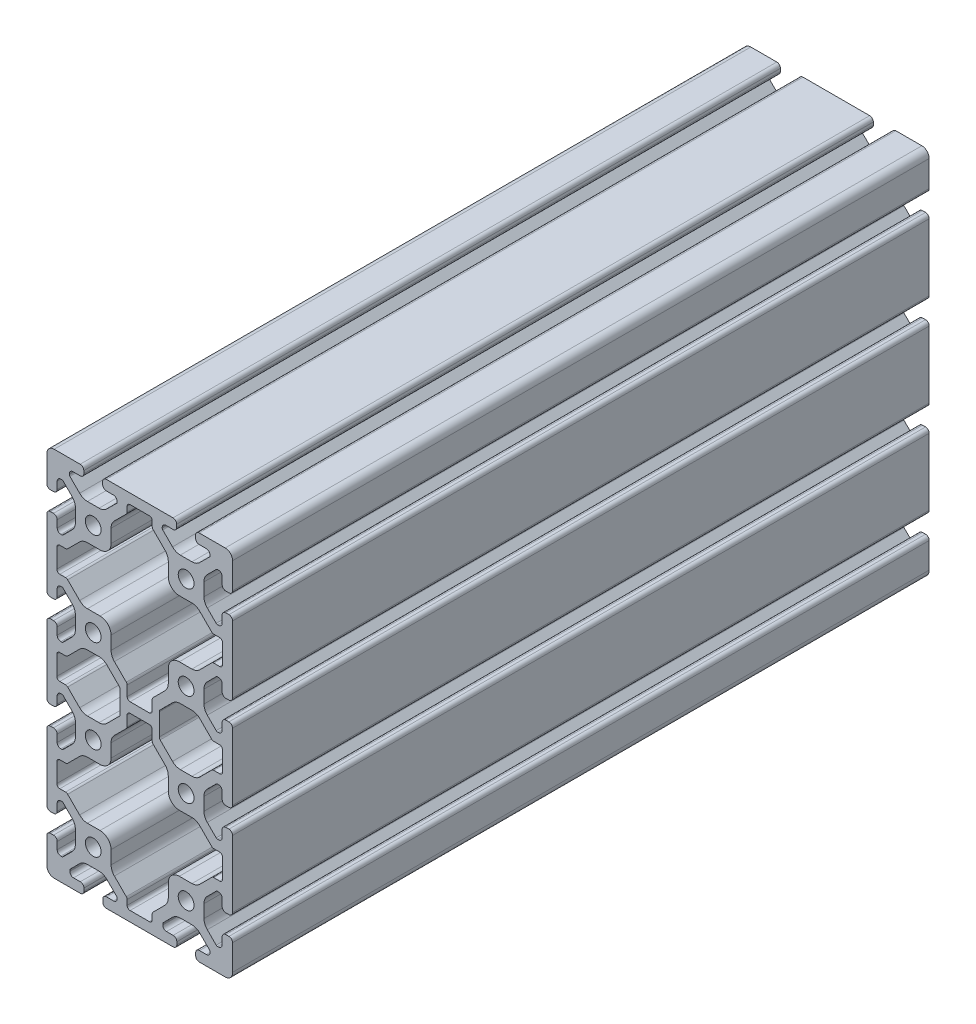
from build123d import *

# Parameters (mm, degrees)
SKETCH1_R      = 3.4
EXTRUDE1_DEPTH = 300


with BuildPart() as part:
    # Sketch1 → Extrude1 (new body)
    with BuildSketch(Plane.XY):
        with BuildLine():
            Line((18.43, 115.94), (17.094615034, 115.94))
            ThreePointArc((17.094615034, 115.94), (15.984457388, 115.480157646), (15.524615034, 114.37))
            Line((15.524615034, 114.37), (15.524615034, 111.285))
            ThreePointArc((15.524615034, 111.285), (15.064772681, 110.174842354), (13.954615034, 109.715))
            Line((13.954615034, 109.715), (13.492503602, 109.715))
            ThreePointArc((13.492503602, 109.715), (13.201664022, 109.772851626), (12.955102186, 109.937599109))
            Line((12.955102186, 109.937599109), (9.109794088, 113.782907733))
            ThreePointArc((9.109794088, 113.782907733), (8.055291919, 115.361081755), (7.685, 117.222664943))
            Line((7.685, 117.222664943), (7.685, 122.777336108))
            ThreePointArc((7.685, 122.777336108), (8.055291919, 124.638919296), (9.109794088, 126.217093319))
            Line((9.109794088, 126.217093319), (12.955102449, 130.062401679))
            ThreePointArc((12.955102449, 130.062401679), (13.201664194, 130.22714897), (13.492503602, 130.285000526))
            Line((13.492503602, 130.285000526), (13.954615034, 130.285000526))
            ThreePointArc((13.954615034, 130.285000526), (15.064772681, 129.825158172), (15.524615034, 128.715000526))
            Line((15.524615034, 128.715000526), (15.524615034, 125.630000526))
            ThreePointArc((15.524615034, 125.630000526), (15.984457388, 124.519842879), (17.094615034, 124.060000526))
            Line((17.094615034, 124.060000526), (18.43, 124.060000526))
            ThreePointArc((18.43, 124.060000526), (19.540157647, 124.519842879), (20, 125.630000526))
            Line((20, 125.630000526), (20, 136.83))
            ThreePointArc((20, 136.83), (19.071528497, 139.071528496), (16.83, 140))
            Line((16.83, 140), (5.630000526, 140))
            ThreePointArc((5.630000526, 140), (4.519842879, 139.540157646), (4.060000526, 138.43))
            Line((4.060000526, 138.43), (4.06, 137.24999625))
            ThreePointArc((4.06, 137.24999625), (4.519842354, 136.139838603), (5.63, 135.67999625))
            Line((5.63, 135.67999625), (8.715399493, 135.67999625))
            ThreePointArc((8.715399493, 135.67999625), (9.825557139, 135.220153896), (10.285399493, 134.10999625))
            Line((10.285399493, 134.10999625), (10.285399493, 133.6200547))
            ThreePointArc((10.285399493, 133.6200547), (10.160433474, 133.35903797), (9.946956001, 133.163657296))
            Line((9.946956001, 133.163657296), (5.859541494, 129.076242789))
            ThreePointArc((5.859541494, 129.076242789), (4.318530587, 128.04657222), (2.500784284, 127.685))
            Line((2.500784284, 127.685), (-2.500784284, 127.685))
            ThreePointArc((-2.500784284, 127.685), (-4.318530588, 128.04657222), (-5.859541494, 129.076242789))
            Line((-5.859541494, 129.076242789), (-10.062800646, 133.279501941))
            ThreePointArc((-10.062800646, 133.279501941), (-10.227547937, 133.526063686), (-10.285399492, 133.816903094))
            Line((-10.285399492, 133.816903094), (-10.285399492, 134.10999625))
            ThreePointArc((-10.285399492, 134.10999625), (-9.825557139, 135.220153896), (-8.715399492, 135.67999625))
            Line((-8.715399492, 135.67999625), (-5.63, 135.67999625))
            ThreePointArc((-5.63, 135.67999625), (-4.519842353, 136.139838603), (-4.06, 137.24999625))
            Line((-4.06, 137.24999625), (-4.06, 138.43))
            ThreePointArc((-4.06, 138.43), (-4.519842353, 139.540157646), (-5.63, 140))
            Line((-5.63, 140), (-34.37, 140))
            ThreePointArc((-34.37, 140), (-35.480157646, 139.540157646), (-35.94, 138.43))
            Line((-35.94, 138.43), (-35.94, 137.24999625))
            ThreePointArc((-35.94, 137.24999625), (-35.480157646, 136.139838603), (-34.37, 135.67999625))
            Line((-34.37, 135.67999625), (-31.284600508, 135.67999625))
            ThreePointArc((-31.284600508, 135.67999625), (-30.174442861, 135.220153896), (-29.714600508, 134.10999625))
            Line((-29.714600508, 134.10999625), (-29.714600508, 133.6200547))
            ThreePointArc((-29.714600508, 133.6200547), (-29.839566526, 133.35903797), (-30.053043999, 133.163657296))
            Line((-30.053043999, 133.163657296), (-34.140458506, 129.076242789))
            ThreePointArc((-34.140458506, 129.076242789), (-35.681469413, 128.04657222), (-37.499215716, 127.685))
            Line((-37.499215716, 127.685), (-42.500784284, 127.685))
            ThreePointArc((-42.500784284, 127.685), (-44.318530587, 128.04657222), (-45.859541494, 129.076242789))
            Line((-45.859541494, 129.076242789), (-50.062800646, 133.279501941))
            ThreePointArc((-50.062800646, 133.279501941), (-50.22754822, 133.526063625), (-50.285400018, 133.816903094))
            Line((-50.285400018, 133.816903094), (-50.285400018, 134.10999625))
            ThreePointArc((-50.285400018, 134.10999625), (-49.825557664, 135.220153896), (-48.715400018, 135.67999625))
            Line((-48.715400018, 135.67999625), (-45.630000525, 135.67999625))
            ThreePointArc((-45.630000525, 135.67999625), (-44.519842879, 136.139838603), (-44.060000525, 137.24999625))
            Line((-44.060000525, 137.24999625), (-44.060000525, 138.43))
            ThreePointArc((-44.060000525, 138.43), (-44.519842879, 139.540157646), (-45.630000525, 140))
            Line((-45.630000525, 140), (-56.83, 140))
            ThreePointArc((-56.83, 140), (-59.071528496, 139.071528496), (-60, 136.83))
            Line((-60, 136.83), (-60, 125.630000526))
            ThreePointArc((-60, 125.630000526), (-59.540157646, 124.519842879), (-58.43, 124.060000526))
            Line((-58.43, 124.060000526), (-57.094615034, 124.060000526))
            ThreePointArc((-57.094615034, 124.060000526), (-55.984457387, 124.519842879), (-55.524615034, 125.630000526))
            Line((-55.524615034, 125.630000526), (-55.524615034, 128.715000526))
            ThreePointArc((-55.524615034, 128.715000526), (-55.06477268, 129.825158172), (-53.954615034, 130.285000526))
            Line((-53.954615034, 130.285000526), (-53.492503602, 130.285000526))
            ThreePointArc((-53.492503602, 130.285000526), (-53.201664193, 130.22714897), (-52.955102448, 130.062401679))
            Line((-52.955102448, 130.062401679), (-49.109794088, 126.217093319))
            ThreePointArc((-49.109794088, 126.217093319), (-48.055291919, 124.638919296), (-47.685, 122.777336108))
            Line((-47.685, 122.777336108), (-47.685, 117.222664943))
            ThreePointArc((-47.685, 117.222664943), (-48.05529199, 115.361081584), (-49.109794351, 113.78290747))
            Line((-49.109794351, 113.78290747), (-52.955102448, 109.937598846))
            ThreePointArc((-52.955102448, 109.937598846), (-53.201664193, 109.772851555), (-53.492503602, 109.715))
            Line((-53.492503602, 109.715), (-53.954615034, 109.715))
            ThreePointArc((-53.954615034, 109.715), (-55.06477268, 110.174842353), (-55.524615034, 111.285))
            Line((-55.524615034, 111.285), (-55.524615034, 114.37))
            ThreePointArc((-55.524615034, 114.37), (-55.984457387, 115.480157646), (-57.094615034, 115.94))
            Line((-57.094615034, 115.94), (-58.43, 115.94))
            ThreePointArc((-58.43, 115.94), (-59.540157646, 115.480157646), (-60, 114.37))
            Line((-60, 114.37), (-60, 85.63))
            ThreePointArc((-60, 85.63), (-59.540157646, 84.519842354), (-58.43, 84.06))
            Line((-58.43, 84.06), (-57.094615034, 84.06))
            ThreePointArc((-57.094615034, 84.06), (-55.984457387, 84.519842354), (-55.524615034, 85.63))
            Line((-55.524615034, 85.63), (-55.524615034, 88.715))
            ThreePointArc((-55.524615034, 88.715), (-55.06477268, 89.825157646), (-53.954615034, 90.285))
            Line((-53.954615034, 90.285), (-53.492503602, 90.285))
            ThreePointArc((-53.492503602, 90.285), (-53.201664193, 90.227148445), (-52.955102448, 90.062401154))
            Line((-52.955102448, 90.062401154), (-49.109794088, 86.217092793))
            ThreePointArc((-49.109794088, 86.217092793), (-48.055291919, 84.63891877), (-47.685, 82.777335583))
            Line((-47.685, 82.777335583), (-47.685, 77.222664418))
            ThreePointArc((-47.685, 77.222664418), (-48.055291919, 75.36108123), (-49.109794088, 73.782907207))
            Line((-49.109794088, 73.782907207), (-52.955102448, 69.937598846))
            ThreePointArc((-52.955102448, 69.937598846), (-53.201664193, 69.772851555), (-53.492503602, 69.715))
            Line((-53.492503602, 69.715), (-53.954615034, 69.715))
            ThreePointArc((-53.954615034, 69.715), (-55.06477268, 70.174842354), (-55.524615034, 71.285))
            Line((-55.524615034, 71.285), (-55.524615034, 74.37))
            ThreePointArc((-55.524615034, 74.37), (-55.984457387, 75.480157646), (-57.094615034, 75.94))
            Line((-57.094615034, 75.94), (-58.43, 75.94))
            ThreePointArc((-58.43, 75.94), (-59.540157646, 75.480157646), (-60, 74.37))
            Line((-60, 74.37), (-60, 45.63))
            ThreePointArc((-60, 45.63), (-59.540157646, 44.519842354), (-58.43, 44.06))
            Line((-58.43, 44.06), (-57.094615034, 44.06))
            ThreePointArc((-57.094615034, 44.06), (-55.984457387, 44.519842354), (-55.524615034, 45.63))
            Line((-55.524615034, 45.63), (-55.524615034, 48.715))
            ThreePointArc((-55.524615034, 48.715), (-55.06477268, 49.825157646), (-53.954615034, 50.285))
            Line((-53.954615034, 50.285), (-53.492503602, 50.285))
            ThreePointArc((-53.492503602, 50.285), (-53.201664193, 50.227148445), (-52.955102448, 50.062401154))
            Line((-52.955102448, 50.062401154), (-49.109794088, 46.217092793))
            ThreePointArc((-49.109794088, 46.217092793), (-48.055291919, 44.63891877), (-47.685, 42.777335582))
            Line((-47.685, 42.777335582), (-47.685, 37.222664418))
            ThreePointArc((-47.685, 37.222664418), (-48.055291919, 35.36108123), (-49.109794088, 33.782907207))
            Line((-49.109794088, 33.782907207), (-52.955102448, 29.937598846))
            ThreePointArc((-52.955102448, 29.937598846), (-53.201664193, 29.772851555), (-53.492503602, 29.715))
            Line((-53.492503602, 29.715), (-53.954615034, 29.715))
            ThreePointArc((-53.954615034, 29.715), (-55.06477268, 30.174842354), (-55.524615034, 31.285))
            Line((-55.524615034, 31.285), (-55.524615034, 34.37))
            ThreePointArc((-55.524615034, 34.37), (-55.984457387, 35.480157646), (-57.094615034, 35.94))
            Line((-57.094615034, 35.94), (-58.43, 35.94))
            ThreePointArc((-58.43, 35.94), (-59.540157646, 35.480157646), (-60, 34.37))
            Line((-60, 34.37), (-60, 5.63))
            ThreePointArc((-60, 5.63), (-59.540157646, 4.519842354), (-58.43, 4.06))
            Line((-58.43, 4.06), (-57.094615034, 4.06))
            ThreePointArc((-57.094615034, 4.06), (-55.984457387, 4.519842354), (-55.524615034, 5.63))
            Line((-55.524615034, 5.63), (-55.524615034, 8.715))
            ThreePointArc((-55.524615034, 8.715), (-55.06477268, 9.825157646), (-53.954615034, 10.285))
            Line((-53.954615034, 10.285), (-53.492503602, 10.285))
            ThreePointArc((-53.492503602, 10.285), (-53.201664193, 10.227148445), (-52.955102448, 10.062401154))
            Line((-52.955102448, 10.062401154), (-49.109794088, 6.217092793))
            ThreePointArc((-49.109794088, 6.217092793), (-48.055291919, 4.63891877), (-47.685, 2.777335582))
            Line((-47.685, 2.777335582), (-47.685, -2.777335582))
            ThreePointArc((-47.685, -2.777335582), (-48.055291919, -4.63891877), (-49.109794088, -6.217092793))
            Line((-49.109794088, -6.217092793), (-52.955102448, -10.062401154))
            ThreePointArc((-52.955102448, -10.062401154), (-53.201664193, -10.227148445), (-53.492503602, -10.285))
            Line((-53.492503602, -10.285), (-53.954615034, -10.285))
            ThreePointArc((-53.954615034, -10.285), (-55.06477268, -9.825157646), (-55.524615034, -8.715))
            Line((-55.524615034, -8.715), (-55.524615034, -5.63))
            ThreePointArc((-55.524615034, -5.63), (-55.984457387, -4.519842353), (-57.094615034, -4.06))
            Line((-57.094615034, -4.06), (-58.43, -4.06))
            ThreePointArc((-58.43, -4.06), (-59.540157646, -4.519842353), (-60, -5.63))
            Line((-60, -5.63), (-60, -16.829999474))
            ThreePointArc((-60, -16.829999474), (-59.071528922, -19.071527545), (-56.830001204, -19.999999474))
            Line((-56.830001204, -19.999999474), (-45.572979645, -20.00000375))
            ThreePointArc((-45.572979645, -20.00000375), (-44.462821613, -19.540161608), (-44.002979049, -18.43000375))
            Line((-44.002979049, -18.43000375), (-44.002979049, -17.25))
            ThreePointArc((-44.002979049, -17.25), (-44.462821402, -16.139842354), (-45.572979049, -15.68))
            Line((-45.572979049, -15.68), (-48.475666997, -15.68))
            ThreePointArc((-48.475666997, -15.68), (-49.605030484, -15.200613642), (-50.044710596, -14.05520779))
            Line((-50.044710596, -14.05520779), (-50.033001361, -13.71989919))
            ThreePointArc((-50.033001361, -13.71989919), (-50.012729352, -13.354224618), (-49.82378784, -13.040489136))
            Line((-49.82378784, -13.040489136), (-45.859541494, -9.076242789))
            ThreePointArc((-45.859541494, -9.076242789), (-44.318530587, -8.046572221), (-42.500784283, -7.685))
            Line((-42.500784283, -7.685), (-37.499215716, -7.685))
            ThreePointArc((-37.499215716, -7.685), (-35.681469412, -8.046572221), (-34.140458505, -9.076242789))
            Line((-34.140458505, -9.076242789), (-29.937199354, -13.279501941))
            ThreePointArc((-29.937199354, -13.279501941), (-29.772452063, -13.526063686), (-29.714600508, -13.816903094))
            Line((-29.714600508, -13.816903094), (-29.714600508, -14.11))
            ThreePointArc((-29.714600508, -14.11), (-30.174442861, -15.220157647), (-31.284600508, -15.68))
            Line((-31.284600508, -15.68), (-34.242080666, -15.68))
            ThreePointArc((-34.242080666, -15.68), (-35.396116802, -16.1152918), (-35.879549629, -17.250003682))
            Line((-35.879549629, -17.250003682), (-35.879550077, -18.430007432))
            ThreePointArc((-35.879550077, -18.430007432), (-35.396116171, -19.564717284), (-34.242081191, -20.000008054))
            Line((-34.242081191, -20.000008054), (-5.572979645, -20.000018944))
            ThreePointArc((-5.572979645, -20.000018944), (-4.462816241, -19.54017143), (-4.002979049, -18.43000375))
            Line((-4.002979049, -18.43000375), (-4.002979049, -17.25))
            ThreePointArc((-4.002979049, -17.25), (-4.462821402, -16.139842354), (-5.572979049, -15.68))
            Line((-5.572979049, -15.68), (-8.475666997, -15.68))
            ThreePointArc((-8.475666997, -15.68), (-9.605030483, -15.200613642), (-10.044710595, -14.05520779))
            Line((-10.044710595, -14.05520779), (-10.033001361, -13.71989919))
            ThreePointArc((-10.033001361, -13.71989919), (-10.012729352, -13.354224618), (-9.82378784, -13.040489136))
            Line((-9.82378784, -13.040489136), (-5.859541494, -9.076242789))
            ThreePointArc((-5.859541494, -9.076242789), (-4.318530587, -8.046572221), (-2.500784283, -7.685))
            Line((-2.500784283, -7.685), (2.500784284, -7.685))
            ThreePointArc((2.500784284, -7.685), (4.318530588, -8.046572221), (5.859541495, -9.076242789))
            Line((5.859541495, -9.076242789), (10.062800646, -13.279501941))
            ThreePointArc((10.062800646, -13.279501941), (10.227547937, -13.526063686), (10.285399493, -13.816903094))
            Line((10.285399493, -13.816903094), (10.285399493, -14.11))
            ThreePointArc((10.285399493, -14.11), (9.825557139, -15.220157647), (8.715399493, -15.68))
            Line((8.715399493, -15.68), (5.757919334, -15.68))
            ThreePointArc((5.757919334, -15.68), (4.604216026, -16.116698343), (4.120449252, -17.251469895))
            Line((4.120449252, -17.251469895), (4.120449252, -18.431473645))
            ThreePointArc((4.120449252, -18.431473645), (4.604407633, -19.565234467), (5.757918809, -20.000023249))
            Line((5.757918809, -20.000023249), (17.018368135, -20.000027526))
            ThreePointArc((17.018368135, -20.000027526), (19.194284481, -18.95159612), (20, -16.674615034))
            Line((20, -16.674615034), (20, -5.63))
            ThreePointArc((20, -5.63), (19.540157647, -4.519842353), (18.43, -4.06))
            Line((18.43, -4.06), (17.094615034, -4.06))
            ThreePointArc((17.094615034, -4.06), (15.984457388, -4.519842353), (15.524615034, -5.63))
            Line((15.524615034, -5.63), (15.524615034, -8.715))
            ThreePointArc((15.524615034, -8.715), (15.064772681, -9.825157646), (13.954615034, -10.285))
            Line((13.954615034, -10.285), (13.492503602, -10.285))
            ThreePointArc((13.492503602, -10.285), (13.201664194, -10.227148445), (12.955102449, -10.062401153))
            Line((12.955102449, -10.062401153), (9.109794088, -6.217092793))
            ThreePointArc((9.109794088, -6.217092793), (8.055291919, -4.63891877), (7.685, -2.777335582))
            Line((7.685, -2.777335582), (7.685, 2.777335582))
            ThreePointArc((7.685, 2.777335582), (8.055291919, 4.63891877), (9.109794088, 6.217092793))
            Line((9.109794088, 6.217092793), (12.955102449, 10.062401154))
            ThreePointArc((12.955102449, 10.062401154), (13.201664194, 10.227148445), (13.492503602, 10.285))
            Line((13.492503602, 10.285), (13.954615034, 10.285))
            ThreePointArc((13.954615034, 10.285), (15.064772681, 9.825157646), (15.524615034, 8.715))
            Line((15.524615034, 8.715), (15.524615034, 5.63))
            ThreePointArc((15.524615034, 5.63), (15.984457388, 4.519842354), (17.094615034, 4.06))
            Line((17.094615034, 4.06), (18.43, 4.06))
            ThreePointArc((18.43, 4.06), (19.540157647, 4.519842354), (20, 5.63))
            Line((20, 5.63), (20, 34.37))
            ThreePointArc((20, 34.37), (19.540157647, 35.480157646), (18.43, 35.94))
            Line((18.43, 35.94), (17.094615034, 35.94))
            ThreePointArc((17.094615034, 35.94), (15.984457388, 35.480157646), (15.524615034, 34.37))
            Line((15.524615034, 34.37), (15.524615034, 31.285))
            ThreePointArc((15.524615034, 31.285), (15.064772681, 30.174842354), (13.954615034, 29.715))
            Line((13.954615034, 29.715), (13.492503602, 29.715))
            ThreePointArc((13.492503602, 29.715), (13.201664194, 29.772851555), (12.955102449, 29.937598846))
            Line((12.955102449, 29.937598846), (9.109794088, 33.782907207))
            ThreePointArc((9.109794088, 33.782907207), (8.055291919, 35.36108123), (7.685, 37.222664417))
            Line((7.685, 37.222664417), (7.685, 42.777335582))
            ThreePointArc((7.685, 42.777335582), (8.055291919, 44.63891877), (9.109794088, 46.217092793))
            Line((9.109794088, 46.217092793), (12.955102449, 50.062401154))
            ThreePointArc((12.955102449, 50.062401154), (13.201664194, 50.227148445), (13.492503602, 50.285))
            Line((13.492503602, 50.285), (13.954615034, 50.285))
            ThreePointArc((13.954615034, 50.285), (15.064772681, 49.825157646), (15.524615034, 48.715))
            Line((15.524615034, 48.715), (15.524615034, 45.63))
            ThreePointArc((15.524615034, 45.63), (15.984457388, 44.519842354), (17.094615034, 44.06))
            Line((17.094615034, 44.06), (18.43, 44.06))
            ThreePointArc((18.43, 44.06), (19.540157647, 44.519842354), (20, 45.63))
            Line((20, 45.63), (20, 74.37))
            ThreePointArc((20, 74.37), (19.540157647, 75.480157646), (18.43, 75.94))
            Line((18.43, 75.94), (17.094615034, 75.94))
            ThreePointArc((17.094615034, 75.94), (15.984457388, 75.480157646), (15.524615034, 74.37))
            Line((15.524615034, 74.37), (15.524615034, 71.285))
            ThreePointArc((15.524615034, 71.285), (15.064772681, 70.174842354), (13.954615034, 69.715))
            Line((13.954615034, 69.715), (13.492503602, 69.715))
            ThreePointArc((13.492503602, 69.715), (13.201664194, 69.772851555), (12.955102449, 69.937598846))
            Line((12.955102449, 69.937598846), (9.109794088, 73.782907207))
            ThreePointArc((9.109794088, 73.782907207), (8.055291919, 75.36108123), (7.685, 77.222664417))
            Line((7.685, 77.222664417), (7.685, 82.777335582))
            ThreePointArc((7.685, 82.777335582), (8.055291919, 84.63891877), (9.109794088, 86.217092793))
            Line((9.109794088, 86.217092793), (12.955102449, 90.062401154))
            ThreePointArc((12.955102449, 90.062401154), (13.201664194, 90.227148445), (13.492503602, 90.285))
            Line((13.492503602, 90.285), (13.954615034, 90.285))
            ThreePointArc((13.954615034, 90.285), (15.064772681, 89.825157646), (15.524615034, 88.715))
            Line((15.524615034, 88.715), (15.524615034, 85.63))
            ThreePointArc((15.524615034, 85.63), (15.984457388, 84.519842354), (17.094615034, 84.06))
            Line((17.094615034, 84.06), (18.43, 84.06))
            ThreePointArc((18.43, 84.06), (19.540157647, 84.519842354), (20, 85.63))
            Line((20, 85.63), (20, 114.37))
            ThreePointArc((20, 114.37), (19.540157647, 115.480157646), (18.43, 115.94))
        make_face()
        with Locations((-40, 40)):
            Circle(SKETCH1_R, mode=Mode.SUBTRACT)
        with Locations((0, 40)):
            Circle(SKETCH1_R, mode=Mode.SUBTRACT)
        with Locations((-40, 120)):
            Circle(SKETCH1_R, mode=Mode.SUBTRACT)
        with Locations((0, 120)):
            Circle(SKETCH1_R, mode=Mode.SUBTRACT)
        with Locations((0, 80)):
            Circle(SKETCH1_R, mode=Mode.SUBTRACT)
        with Locations((-40, 80)):
            Circle(SKETCH1_R, mode=Mode.SUBTRACT)
        Circle(SKETCH1_R, mode=Mode.SUBTRACT)
        with Locations((-40, 0)):
            Circle(SKETCH1_R, mode=Mode.SUBTRACT)
        with BuildLine():
            Line((-24.13, 57.84), (-15.87, 57.84))
            ThreePointArc((-15.87, 57.84), (-14.971974388, 57.468025612), (-14.6, 56.57))
            Line((-14.6, 56.57), (-14.6, 52.233349929))
            ThreePointArc((-14.6, 52.233349929), (-14.503327006, 51.74734197), (-14.228025612, 51.335324317))
            Line((-14.228025612, 51.335324317), (-9.109794088, 46.217092793))
            ThreePointArc((-9.109794088, 46.217092793), (-8.055291919, 44.638918771), (-7.685, 42.777335583))
            Line((-7.685, 42.777335583), (-7.685, 37.065))
            ThreePointArc((-7.685, 37.065), (-6.293757211, 33.70624279), (-2.935, 32.315))
            Line((-2.935, 32.315), (2.500784284, 32.315))
            ThreePointArc((2.500784284, 32.315), (4.318530588, 31.95342778), (5.859541495, 30.923757211))
            Line((5.859541495, 30.923757211), (11.011324318, 25.771974388))
            ThreePointArc((11.011324318, 25.771974388), (11.423341971, 25.496672994), (11.90934993, 25.4))
            Line((11.90934993, 25.4), (14.41, 25.4))
            ThreePointArc((14.41, 25.4), (15.308025612, 25.028025612), (15.68, 24.13))
            Line((15.68, 24.13), (15.68, 15.87))
            ThreePointArc((15.68, 15.87), (15.308025612, 14.971974388), (14.41, 14.6))
            Line((14.41, 14.6), (11.90934993, 14.6))
            ThreePointArc((11.90934993, 14.6), (11.423341971, 14.503327006), (11.011324318, 14.228025612))
            Line((11.011324318, 14.228025612), (5.859541495, 9.076242789))
            ThreePointArc((5.859541495, 9.076242789), (4.318530588, 8.046572221), (2.500784284, 7.685))
            Line((2.500784284, 7.685), (-2.935, 7.685))
            ThreePointArc((-2.935, 7.685), (-6.293757211, 6.293757211), (-7.685, 2.935))
            Line((-7.685, 2.935), (-7.685, -2.777335582))
            ThreePointArc((-7.685, -2.777335582), (-8.055292426, -4.638919995), (-9.109795963, -6.217094668))
            Line((-9.109795963, -6.217094668), (-14.228025612, -11.335328067))
            ThreePointArc((-14.228025612, -11.335328067), (-14.503327006, -11.74734572), (-14.6, -12.23335368))
            Line((-14.6, -12.23335368), (-14.6, -14.41))
            ThreePointArc((-14.6, -14.41), (-14.971974388, -15.308025612), (-15.87, -15.68))
            Line((-15.87, -15.68), (-24.13, -15.68))
            ThreePointArc((-24.13, -15.68), (-25.028025612, -15.308025612), (-25.4, -14.41))
            Line((-25.4, -14.41), (-25.4, -12.23335368))
            ThreePointArc((-25.4, -12.23335368), (-25.496673501, -11.747344495), (-25.771976263, -11.335326192))
            Line((-25.771976263, -11.335326192), (-30.890205912, -6.217092793))
            ThreePointArc((-30.890205912, -6.217092793), (-31.944708081, -4.63891877), (-32.315, -2.777335582))
            Line((-32.315, -2.777335582), (-32.315, 2.935))
            ThreePointArc((-32.315, 2.935), (-33.706242789, 6.293757211), (-37.065, 7.685))
            Line((-37.065, 7.685), (-42.500784284, 7.685))
            ThreePointArc((-42.500784284, 7.685), (-44.318530587, 8.04657222), (-45.859541494, 9.076242789))
            Line((-45.859541494, 9.076242789), (-51.011324317, 14.228025612))
            ThreePointArc((-51.011324317, 14.228025612), (-51.42334197, 14.503327006), (-51.909349929, 14.599999999))
            Line((-51.909349929, 14.599999999), (-54.41, 14.599999999))
            ThreePointArc((-54.41, 14.599999999), (-55.308025612, 14.971974387), (-55.68, 15.869999999))
            Line((-55.68, 15.869999999), (-55.68, 24.13))
            ThreePointArc((-55.68, 24.13), (-55.308025612, 25.028025612), (-54.41, 25.4))
            Line((-54.41, 25.4), (-51.909349929, 25.4))
            ThreePointArc((-51.909349929, 25.4), (-51.42334197, 25.496672993), (-51.011324317, 25.771974388))
            Line((-51.011324317, 25.771974388), (-45.859541494, 30.923757211))
            ThreePointArc((-45.859541494, 30.923757211), (-44.318530587, 31.953427779), (-42.500784284, 32.315))
            Line((-42.500784284, 32.315), (-37.065, 32.315))
            ThreePointArc((-37.065, 32.315), (-33.706242789, 33.706242789), (-32.315, 37.065))
            Line((-32.315, 37.065), (-32.315, 42.777335582))
            ThreePointArc((-32.315, 42.777335582), (-31.944708081, 44.63891877), (-30.890205912, 46.217092793))
            Line((-30.890205912, 46.217092793), (-25.771974388, 51.335324317))
            ThreePointArc((-25.771974388, 51.335324317), (-25.496672994, 51.74734197), (-25.4, 52.233349929))
            Line((-25.4, 52.233349929), (-25.4, 56.57))
            ThreePointArc((-25.4, 56.57), (-25.028025612, 57.468025612), (-24.13, 57.84))
        make_face(mode=Mode.SUBTRACT)
        with BuildLine():
            Line((-28.801974388, 54.414726907), (-34.140458505, 49.076242789))
            ThreePointArc((-34.140458505, 49.076242789), (-35.681469412, 48.04657222), (-37.499215716, 47.685))
            Line((-37.499215716, 47.685), (-42.500784283, 47.685))
            ThreePointArc((-42.500784283, 47.685), (-44.318530587, 48.046572221), (-45.859541494, 49.076242789))
            Line((-45.859541494, 49.076242789), (-51.011324317, 54.228025612))
            ThreePointArc((-51.011324317, 54.228025612), (-51.42334197, 54.503327006), (-51.909349929, 54.6))
            Line((-51.909349929, 54.6), (-54.41, 54.6))
            ThreePointArc((-54.41, 54.6), (-55.308025612, 54.971974388), (-55.68, 55.87))
            Line((-55.68, 55.87), (-55.68, 64.13))
            ThreePointArc((-55.68, 64.13), (-55.308025612, 65.028025612), (-54.41, 65.4))
            Line((-54.41, 65.4), (-51.909349929, 65.4))
            ThreePointArc((-51.909349929, 65.4), (-51.42334197, 65.496672994), (-51.011324317, 65.771974388))
            Line((-51.011324317, 65.771974388), (-45.859541494, 70.923757211))
            ThreePointArc((-45.859541494, 70.923757211), (-44.318530587, 71.95342778), (-42.500784284, 72.315))
            Line((-42.500784284, 72.315), (-37.499215716, 72.315))
            ThreePointArc((-37.499215716, 72.315), (-35.681469413, 71.95342778), (-34.140458506, 70.923757211))
            Line((-34.140458506, 70.923757211), (-28.801974388, 65.585273094))
            ThreePointArc((-28.801974388, 65.585273094), (-28.526672994, 65.173255441), (-28.43, 64.687247481))
            Line((-28.43, 64.687247481), (-28.43, 55.312752519))
            ThreePointArc((-28.43, 55.312752519), (-28.526672994, 54.82674456), (-28.801974388, 54.414726907))
        make_face(mode=Mode.SUBTRACT)
        with BuildLine():
            Line((-11.57, 55.312752519), (-11.57, 64.687247482))
            ThreePointArc((-11.57, 64.687247482), (-11.473327006, 65.173255441), (-11.198025612, 65.585273093))
            Line((-11.198025612, 65.585273093), (-5.859541494, 70.923757211))
            ThreePointArc((-5.859541494, 70.923757211), (-4.318530588, 71.95342778), (-2.500784284, 72.315))
            Line((-2.500784284, 72.315), (2.500784283, 72.315))
            ThreePointArc((2.500784283, 72.315), (4.318530587, 71.95342778), (5.859541494, 70.923757211))
            Line((5.859541494, 70.923757211), (11.011324317, 65.771974388))
            ThreePointArc((11.011324317, 65.771974388), (11.423341971, 65.496672994), (11.90934993, 65.4))
            Line((11.90934993, 65.4), (14.41, 65.4))
            ThreePointArc((14.41, 65.4), (15.308025612, 65.028025612), (15.68, 64.13))
            Line((15.68, 64.13), (15.68, 55.87))
            ThreePointArc((15.68, 55.87), (15.308025612, 54.971974388), (14.41, 54.6))
            Line((14.41, 54.6), (11.90934993, 54.6))
            ThreePointArc((11.90934993, 54.6), (11.423341971, 54.503327006), (11.011324317, 54.228025612))
            Line((11.011324317, 54.228025612), (5.859541494, 49.076242789))
            ThreePointArc((5.859541494, 49.076242789), (4.318530587, 48.046572221), (2.500784283, 47.685))
            Line((2.500784283, 47.685), (-2.500784284, 47.685))
            ThreePointArc((-2.500784284, 47.685), (-4.318530588, 48.046572221), (-5.859541495, 49.076242789))
            Line((-5.859541495, 49.076242789), (-11.198025612, 54.414726907))
            ThreePointArc((-11.198025612, 54.414726907), (-11.473327006, 54.82674456), (-11.57, 55.312752519))
        make_face(mode=Mode.SUBTRACT)
        with BuildLine():
            Line((-15.87, 62.16), (-24.13, 62.16))
            ThreePointArc((-24.13, 62.16), (-25.028025612, 62.531974388), (-25.4, 63.43))
            Line((-25.4, 63.43), (-25.4, 67.766650071))
            ThreePointArc((-25.4, 67.766650071), (-25.496672994, 68.25265803), (-25.771974388, 68.664675683))
            Line((-25.771974388, 68.664675683), (-30.890205912, 73.782907207))
            ThreePointArc((-30.890205912, 73.782907207), (-31.944708081, 75.36108123), (-32.315, 77.222664417))
            Line((-32.315, 77.222664417), (-32.315, 82.935))
            ThreePointArc((-32.315, 82.935), (-33.706242789, 86.293757211), (-37.065, 87.685))
            Line((-37.065, 87.685), (-42.500784284, 87.685))
            ThreePointArc((-42.500784284, 87.685), (-44.318530587, 88.04657222), (-45.859541494, 89.076242789))
            Line((-45.859541494, 89.076242789), (-51.011324317, 94.228025612))
            ThreePointArc((-51.011324317, 94.228025612), (-51.42334197, 94.503327006), (-51.909349929, 94.6))
            Line((-51.909349929, 94.6), (-54.41, 94.6))
            ThreePointArc((-54.41, 94.6), (-55.308025612, 94.971974388), (-55.68, 95.87))
            Line((-55.68, 95.87), (-55.68, 104.13))
            ThreePointArc((-55.68, 104.13), (-55.308025612, 105.028025612), (-54.41, 105.4))
            Line((-54.41, 105.4), (-51.909349929, 105.4))
            ThreePointArc((-51.909349929, 105.4), (-51.42334197, 105.496672994), (-51.011324317, 105.771974388))
            Line((-51.011324317, 105.771974388), (-45.859541494, 110.923757211))
            ThreePointArc((-45.859541494, 110.923757211), (-44.318530587, 111.95342778), (-42.500784284, 112.315))
            Line((-42.500784284, 112.315), (-37.065, 112.315))
            ThreePointArc((-37.065, 112.315), (-33.706242789, 113.706242789), (-32.315, 117.065))
            Line((-32.315, 117.065), (-32.315, 122.777335582))
            ThreePointArc((-32.315, 122.777335582), (-31.944708081, 124.63891877), (-30.890205912, 126.217092793))
            Line((-30.890205912, 126.217092793), (-25.771974388, 131.335324317))
            ThreePointArc((-25.771974388, 131.335324317), (-25.496672994, 131.74734197), (-25.4, 132.233349929))
            Line((-25.4, 132.233349929), (-25.4, 134.40999625))
            ThreePointArc((-25.4, 134.40999625), (-25.028025612, 135.308021862), (-24.13, 135.67999625))
            Line((-24.13, 135.67999625), (-15.87, 135.67999625))
            ThreePointArc((-15.87, 135.67999625), (-14.971974388, 135.308021862), (-14.6, 134.40999625))
            Line((-14.6, 134.40999625), (-14.6, 132.233349929))
            ThreePointArc((-14.6, 132.233349929), (-14.503327006, 131.74734197), (-14.228025612, 131.335324317))
            Line((-14.228025612, 131.335324317), (-9.109794088, 126.217092793))
            ThreePointArc((-9.109794088, 126.217092793), (-8.055291919, 124.63891877), (-7.685, 122.777335582))
            Line((-7.685, 122.777335582), (-7.685, 117.065))
            ThreePointArc((-7.685, 117.065), (-6.293757211, 113.706242789), (-2.935, 112.315))
            Line((-2.935, 112.315), (2.500784284, 112.315))
            ThreePointArc((2.500784284, 112.315), (4.318530588, 111.953427779), (5.859541495, 110.923757211))
            Line((5.859541495, 110.923757211), (11.011324318, 105.771974388))
            ThreePointArc((11.011324318, 105.771974388), (11.423341971, 105.496672994), (11.90934993, 105.4))
            Line((11.90934993, 105.4), (14.41, 105.4))
            ThreePointArc((14.41, 105.4), (15.308025612, 105.028025612), (15.68, 104.13))
            Line((15.68, 104.13), (15.68, 95.87))
            ThreePointArc((15.68, 95.87), (15.308025612, 94.971974388), (14.41, 94.6))
            Line((14.41, 94.6), (11.90934993, 94.6))
            ThreePointArc((11.90934993, 94.6), (11.423341971, 94.503327006), (11.011324318, 94.228025612))
            Line((11.011324318, 94.228025612), (5.859541495, 89.076242789))
            ThreePointArc((5.859541495, 89.076242789), (4.318530588, 88.04657222), (2.500784284, 87.685))
            Line((2.500784284, 87.685), (-2.935, 87.685))
            ThreePointArc((-2.935, 87.685), (-6.293757211, 86.29375721), (-7.685, 82.935))
            Line((-7.685, 82.935), (-7.685, 77.222664417))
            ThreePointArc((-7.685, 77.222664417), (-8.055291919, 75.361081229), (-9.109794088, 73.782907207))
            Line((-9.109794088, 73.782907207), (-14.228025612, 68.664675683))
            ThreePointArc((-14.228025612, 68.664675683), (-14.503327006, 68.25265803), (-14.6, 67.766650071))
            Line((-14.6, 67.766650071), (-14.6, 63.43))
            ThreePointArc((-14.6, 63.43), (-14.971974388, 62.531974388), (-15.87, 62.16))
        make_face(mode=Mode.SUBTRACT)
    extrude(amount=-EXTRUDE1_DEPTH)


solid = part.part
